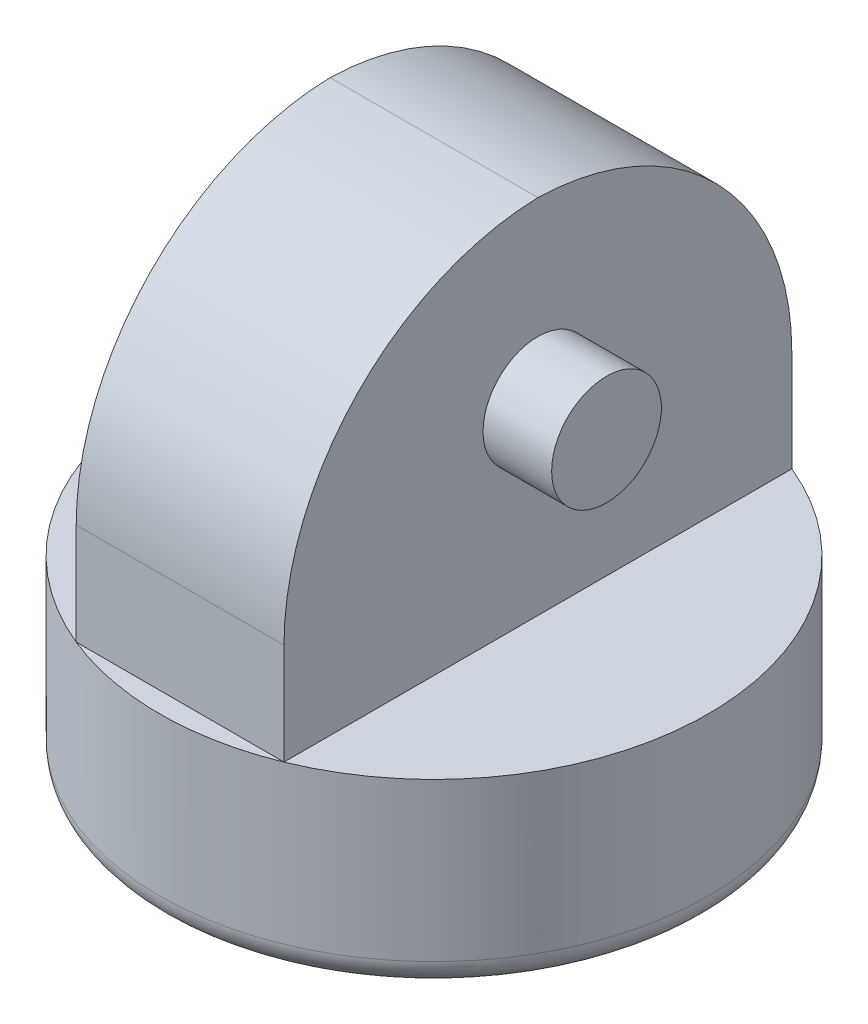
from build123d import *

# Parameters (mm, degrees)
CROQUIS1_R                   = 20
SALIENTE_EXTRUIR1_DEPTH      = 13.5
REDONDEO1_R                  = 2
CROQUIS2_W                   = 15.149467894
CROQUIS2_H                   = 37.020178586
SALIENTE_EXTRUIR2_DEPTH      = 26.39
SALIENTE_EXTRUIR3_DEPTH      = 5
SALIENTE_EXTRUIR3_DEPTH_BACK = 20.15
CROQUIS3_R                   = 4
REDONDEO2_R                  = 19


with BuildPart() as part:
    # Croquis1 → Saliente-Extruir1 (new body)
    with BuildSketch(Plane(origin=(0, 0, 0), x_dir=(1, 0, 0), z_dir=(0, 1, 0))):
        with Locations(Location((0, 0, 0), (0, 0, 270))):
            Circle(CROQUIS1_R)
    extrude(amount=SALIENTE_EXTRUIR1_DEPTH)

    # Redondeo1
    redondeo1_edges = [part.edges().sort_by_distance(p)[0] for p in [
        (0, 0, -20),
    ]]
    fillet(redondeo1_edges, radius=REDONDEO1_R)

    # Croquis2 → Saliente-Extruir2 (add)
    with BuildSketch(Plane(origin=(0, 13.5, 0), x_dir=(1, 0, 0), z_dir=(0, 1, 0))):
        Rectangle(CROQUIS2_W, CROQUIS2_H)
    extrude(amount=SALIENTE_EXTRUIR2_DEPTH)

    # Croquis3 → Saliente-Extruir3 (add, two sides: drawn at the far end of the back side and taken through both)
    with BuildSketch(Plane.ZY.offset(7.574733947).offset(-SALIENTE_EXTRUIR3_DEPTH_BACK)):
        with Locations((0, 27.11)):
            Circle(CROQUIS3_R)
    extrude(amount=SALIENTE_EXTRUIR3_DEPTH + SALIENTE_EXTRUIR3_DEPTH_BACK)

    # Redondeo2
    # the kernel refuses this fillet: 19 mm, written as the material it takes off along each edge
    with BuildSketch(Plane(origin=(55.074733947, 39.89, 18.510089293), x_dir=(0, -1, 0), z_dir=(-1, 0, 0)), Plane(origin=(-55.074733947, 39.89, -18.510089293), x_dir=(0, -1, 0), z_dir=(1, 0, 0))) as redondeo2_piece_1:
        with BuildLine():
            CenterArc((REDONDEO2_R, -REDONDEO2_R), REDONDEO2_R, 90, 90)
            Line((0, -REDONDEO2_R), (0, 0))
            Line((0, 0), (REDONDEO2_R, 0))
        make_face()
    extrude(amount=110.149467894, mode=Mode.SUBTRACT)


solid = part.part
